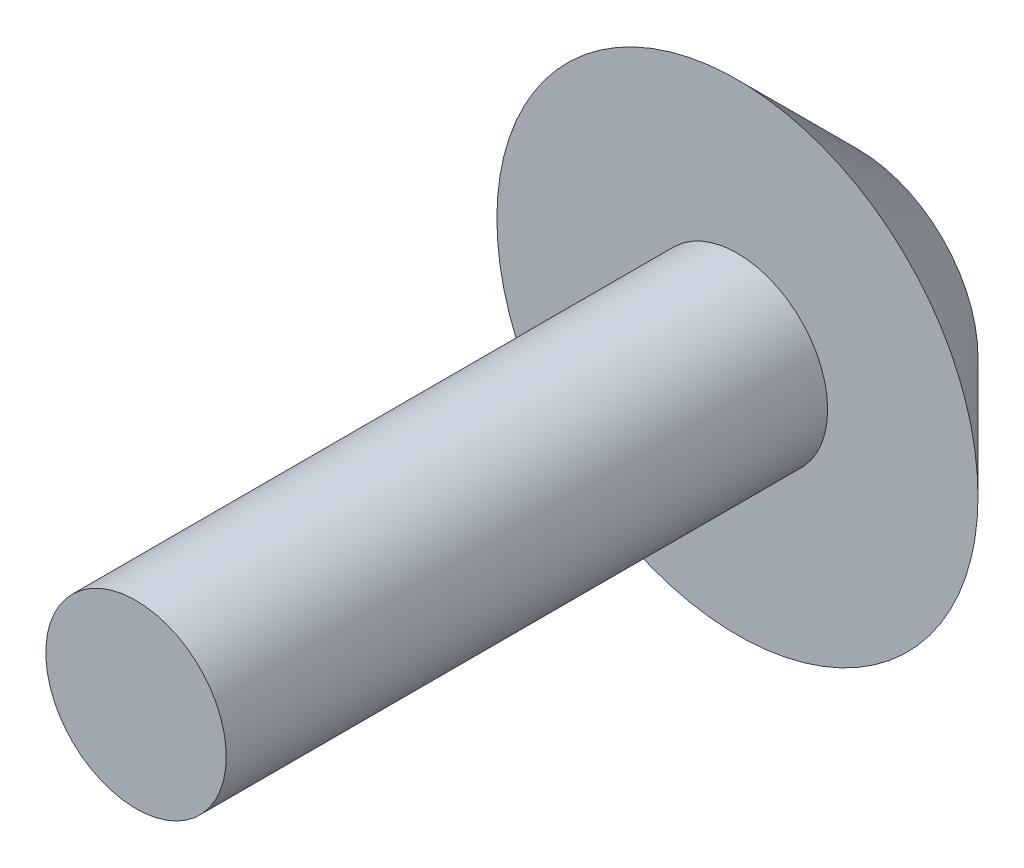
from build123d import *

# Parameters (mm, degrees)
SKETCH1_R           = 1.5
BOSS_EXTRUDE2_DEPTH = 10
SKETCH1_8_R         = 4
SKETCH1_8_R_2       = 1.5
BOSS_EXTRUDE4_DEPTH = 2
BOSS_EXTRUDE5_START = 2
SKETCH2_R           = 1.5
BOSS_EXTRUDE5_DEPTH = 2
CUT_EXTRUDE2_DEPTH  = 1.5
CHAMFER1_SIZE       = 2


with BuildPart() as part:
    # Sketch1 → Boss-Extrude2 (new body)
    with BuildSketch(Plane.XY):
        Circle(SKETCH1_R)
    extrude(amount=BOSS_EXTRUDE2_DEPTH)



with BuildPart() as body_2:
    # Sketch1<8> → Boss-Extrude4 (new body)
    with BuildSketch(Plane.XY):
        Circle(SKETCH1_8_R)
        Circle(SKETCH1_8_R_2, mode=Mode.SUBTRACT)
    extrude(amount=-BOSS_EXTRUDE4_DEPTH)


with BuildPart() as part_1:
    add(part.part)

    add(body_2.part)  # Boss-Extrude5 merges body 2
    # Sketch2 → Boss-Extrude5 (add)
    with BuildSketch(Plane(origin=(0, 0, 0), x_dir=(-1, 0, 0), z_dir=(0, 0, -1)).offset(BOSS_EXTRUDE5_START)):
        with Locations(Location((0, 0, 0), (0, 0, 180))):
            Circle(SKETCH2_R)
    extrude(amount=-BOSS_EXTRUDE5_DEPTH)

    # Sketch3 → Cut-Extrude2 (cut)
    with BuildSketch(Plane(origin=(0, 0, -2), x_dir=(-1, 0, 0), z_dir=(0, 0, -1))):
        Polygon((0, 1.947036768), (-1.686183303, 0.973518384), (-1.686183303, -0.973518384), (0, -1.947036768), (1.686183303, -0.973518384), (1.686183303, 0.973518384), align=None)
    extrude(amount=-CUT_EXTRUDE2_DEPTH, mode=Mode.SUBTRACT)

    # Chamfer1
    chamfer1_edges = [part_1.edges().sort_by_distance(p)[0] for p in [
        (-4, 0, -2),
    ]]
    chamfer(chamfer1_edges, length=CHAMFER1_SIZE - 0.0001)  # a hair under: the kernel refuses the full size


solid = part_1.part
